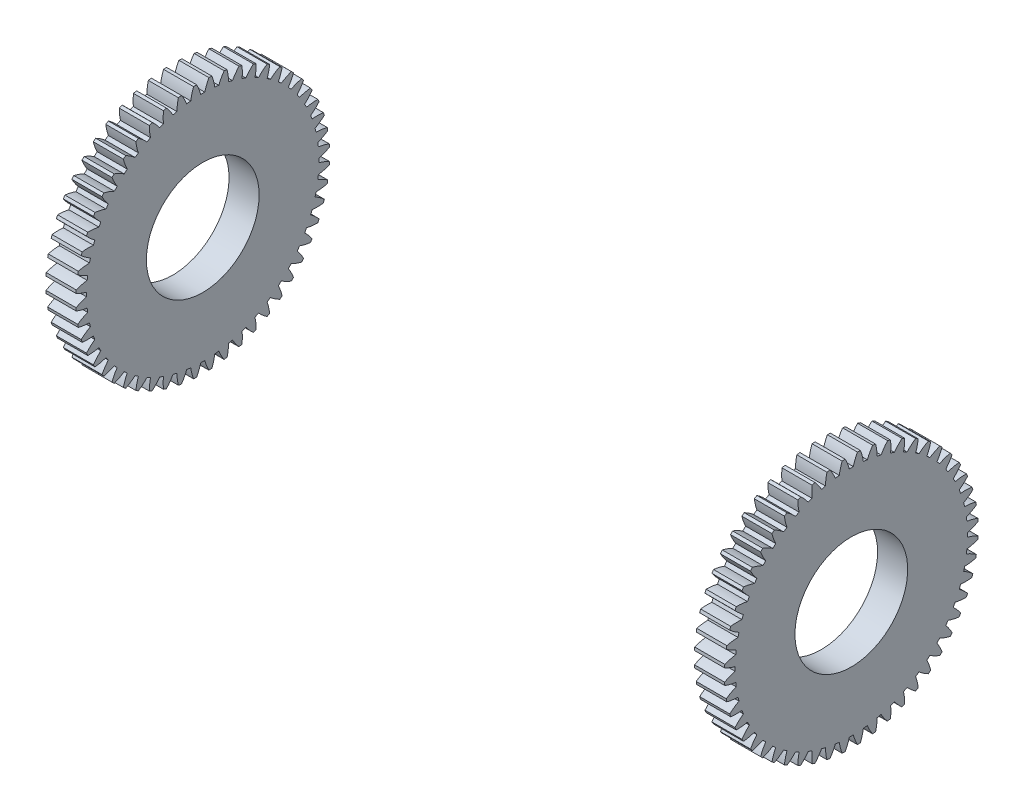
from build123d import *

# Parameters (mm, degrees)
BASPROSKE_W     = 5.08
BASPROSKE_H     = 21.43125
TOOTHCUT_DEPTH  = 31.731146303
TEETHCUTS_COUNT = 52
TEETHCUTS_ANGLE = 353.076923077
BORSKE_R        = 9.525
BORE_DEPTH      = 50.8000508


with BuildPart() as part:
    # BasProSke → Base-Revolve (revolve)
    with BuildSketch(Plane(origin=(0, 0, 0), x_dir=(1, 0, 0), z_dir=(0, 1, 0))):
        with Locations((2.54, 10.715625)):
            Rectangle(BASPROSKE_W, BASPROSKE_H)
    revolve(axis=Axis((-10, 0, 0), (1, 0, 0)))

    # TooCutSke → ToothCut (cut, through all)
    with BuildSketch(Plane(origin=(0, 0, 0), x_dir=(0, 0, -1), z_dir=(1, 0, 0))):
        with BuildLine():
            ThreePointArc((0.340444385, 19.631248235), (0, 19.6342), (-0.340444385, 19.631248235))
            ThreePointArc((-0.340444385, 19.631248235), (-0.64320584, 20.551967762), (-1.051795873, 21.430855201))
            ThreePointArc((-1.051795873, 21.430855201), (0, 21.45665), (1.051795873, 21.430855201))
            ThreePointArc((1.051795873, 21.430855201), (0.64320584, 20.551967762), (0.340444385, 19.631248235))
        make_face()
    toothcut = extrude(amount=TOOTHCUT_DEPTH, mode=Mode.SUBTRACT)

    # TeethCuts: ToothCut ×52 about axis
    teethcuts_axis = Axis((-10, 0, 0), (1, 0, 0))
    for i in range(1, TEETHCUTS_COUNT):
        add(toothcut.rotate(teethcuts_axis, i * TEETHCUTS_ANGLE / (TEETHCUTS_COUNT - 1)), mode=Mode.SUBTRACT)

    # BorSke → Bore (cut, symmetric)
    with BuildSketch(Plane(origin=(0, 0, 0), x_dir=(0, 0, -1), z_dir=(1, 0, 0))):
        Circle(BORSKE_R)
    extrude(amount=BORE_DEPTH, both=True, mode=Mode.SUBTRACT)


with BuildPart() as body_2:
    # Mirror1: mirrored copy
    add(part.part.mirror(Plane(origin=(-52.249999952, 0, 0), x_dir=(0, 0, 1), z_dir=(1, 0, 0))))


solid = Compound([part.part, body_2.part])
